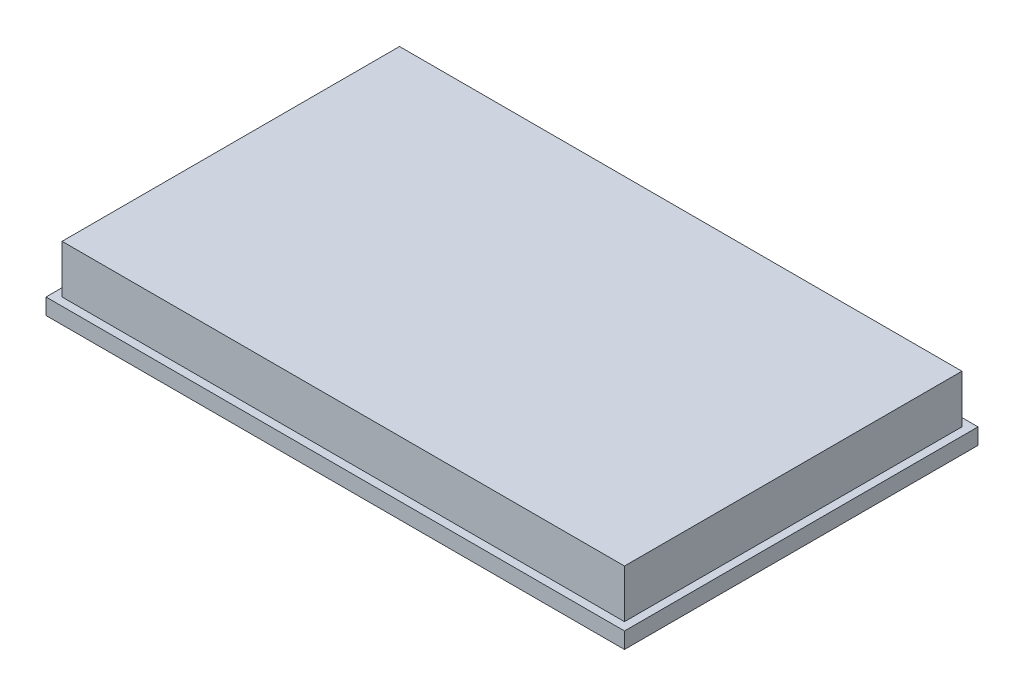
from build123d import *

# Parameters (mm, degrees)
SKETCH1_W           = 457.2
SKETCH1_H           = 279.4
BOSS_EXTRUDE1_DEPTH = 12.7
BOSS_EXTRUDE2_START = 12.7
SKETCH2_W           = 444.5
SKETCH2_H           = 266.7
BOSS_EXTRUDE2_DEPTH = 38.1


with BuildPart() as part:
    # Sketch1 → Boss-Extrude1 (new body)
    with BuildSketch(Plane(origin=(0, 0, 0), x_dir=(1, 0, 0), z_dir=(0, 1, 0))):
        Rectangle(SKETCH1_W, SKETCH1_H)
    extrude(amount=BOSS_EXTRUDE1_DEPTH)

    # Sketch2 → Boss-Extrude2 (add)
    with BuildSketch(Plane(origin=(0, 0, 0), x_dir=(1, 0, 0), z_dir=(0, 1, 0)).offset(BOSS_EXTRUDE2_START)):
        Rectangle(SKETCH2_W, SKETCH2_H)
    extrude(amount=BOSS_EXTRUDE2_DEPTH)


solid = part.part
